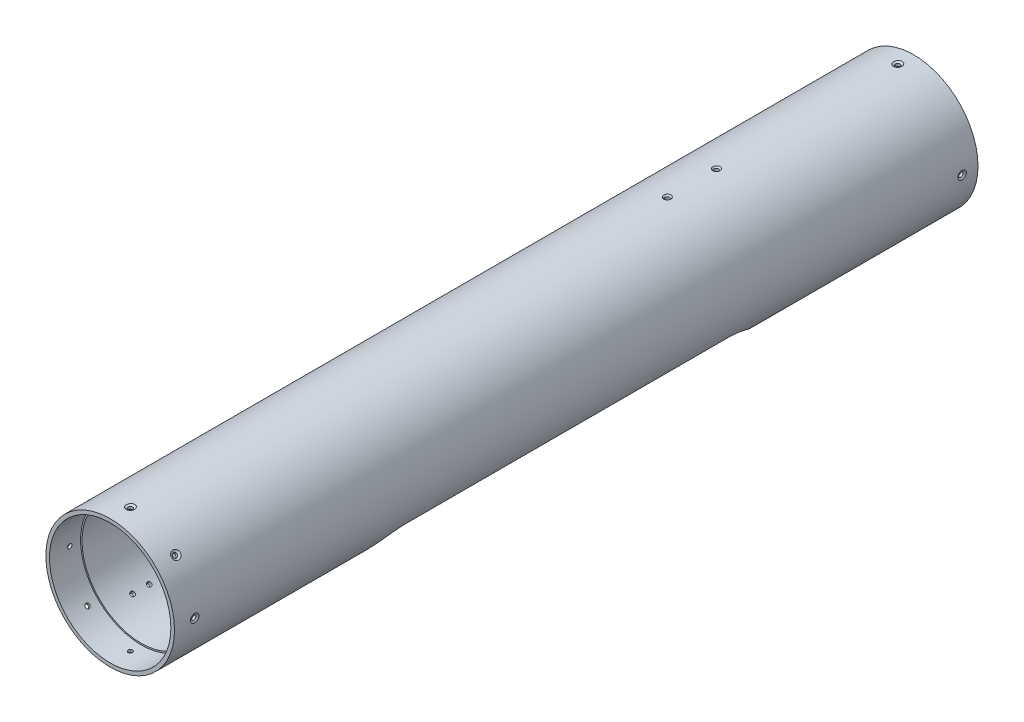
from build123d import *

# Parameters (mm, degrees)
ESQUISSE1_R                  = 44.5
ESQUISSE1_R_2                = 41
BOSS_EXTRU_1_DEPTH           = 556
D_GAGEMENT_M2_51_D           = 3.1
D_GAGEMENT_M2_51_CSINK_D     = 6
D_GAGEMENT_M2_51_CSINK_ANGLE = 120
R_P_TITION_CIRCULAIRE1_COUNT = 4
D_GAGEMENT_M2_52_D           = 3.1
D_GAGEMENT_M2_52_CSINK_D     = 6
D_GAGEMENT_M2_52_CSINK_ANGLE = 120
R_P_TITION_CIRCULAIRE2_COUNT = 8
ENL_V_MAT_EXTRU_1_DEPTH      = 111.46
ENL_V_MAT_EXTRU_1_DEPTH_BACK = 111.46
ENL_V_MAT_EXTRU_2_DEPTH      = 560.550265954
ESQUISSE9_R                  = 42
ESQUISSE9_R_2                = 41
ENL_V_MAT_EXTRU_3_DEPTH      = 18
ENL_V_START                  = -21.5
ESQUISSE10_R                 = 42
ESQUISSE10_R_2               = 41
ENL_V_MAT_EXTRU_4_DEPTH      = 21.5
D_GAGEMENT_M31_D             = 3.1
D_GAGEMENT_M31_CSINK_D       = 5
D_GAGEMENT_M31_CSINK_ANGLE   = 90


with BuildPart() as part:
    # Esquisse1 → Boss.-Extru.1 (new body)
    with BuildSketch(Plane.XY):
        Circle(ESQUISSE1_R)
        Circle(ESQUISSE1_R_2, mode=Mode.SUBTRACT)
    extrude(amount=BOSS_EXTRU_1_DEPTH)

    # Dégagement M2.51 (through all)
    with Locations(Plane(origin=(44.5, 0, 11), x_dir=(0, 1, 0), z_dir=(1, 0, 0))):
        with Locations((0, 0)):
            d_gagement_m2_51 = CounterSinkHole(D_GAGEMENT_M2_51_D / 2, D_GAGEMENT_M2_51_CSINK_D / 2, counter_sink_angle=D_GAGEMENT_M2_51_CSINK_ANGLE)

    # Répétition circulaire1: Dégagement M2.51 ×4 about axis
    r_p_tition_circulaire1_axis = Axis((0, 0, 0), (0, 0, 1))
    for i in range(1, R_P_TITION_CIRCULAIRE1_COUNT):
        add(d_gagement_m2_51.rotate(r_p_tition_circulaire1_axis, i * 360 / R_P_TITION_CIRCULAIRE1_COUNT), mode=Mode.SUBTRACT)

    # Dégagement M2.52 (through all)
    with Locations(Plane(origin=(-44.5, 0, 542), x_dir=(0, 0, -1), z_dir=(-1, 0, 0))):
        with Locations((0, 0)):
            d_gagement_m2_52 = CounterSinkHole(D_GAGEMENT_M2_52_D / 2, D_GAGEMENT_M2_52_CSINK_D / 2, counter_sink_angle=D_GAGEMENT_M2_52_CSINK_ANGLE)

    # Répétition circulaire2: Dégagement M2.52 ×8 about axis
    r_p_tition_circulaire2_axis = Axis((0, 0, 556), (0, 0, 1))
    for i in range(1, R_P_TITION_CIRCULAIRE2_COUNT):
        add(d_gagement_m2_52.rotate(r_p_tition_circulaire2_axis, i * 360 / R_P_TITION_CIRCULAIRE2_COUNT), mode=Mode.SUBTRACT)

    # Esquisse4 → Enlèv. mat.-Extru.1 (cut, two sides: drawn at the far end of the back side and taken through both)
    with BuildSketch(Plane.XY.offset(278).offset(-ENL_V_MAT_EXTRU_1_DEPTH_BACK)):
        with BuildLine():
            Line((-38.538130468, 0), (38.538130468, 0))
            Line((38.538130468, 0), (38.538130468, -22.25))
            ThreePointArc((38.538130468, -22.25), (0, -44.5), (-38.538130468, -22.25))
            Line((-38.538130468, -22.25), (-38.538130468, 0))
        make_face()
    extrude(amount=ENL_V_MAT_EXTRU_1_DEPTH + ENL_V_MAT_EXTRU_1_DEPTH_BACK, mode=Mode.SUBTRACT)

    # Esquisse5 → Enlèv. mat.-Extru.2 (cut, through all)
    with BuildSketch(Plane(origin=(0, 0, 0), x_dir=(1, 0, 0), z_dir=(0, 1, 0))):
        with BuildLine():
            Line((-38.538130468, -389.46), (38.538130468, -389.46))
            ThreePointArc((38.538130468, -389.46), (0, -427.998130468), (-38.538130468, -389.46))
        make_face()
    enl_v_mat_extru_2 = extrude(amount=-ENL_V_MAT_EXTRU_2_DEPTH, mode=Mode.SUBTRACT)

    # Symétrie1: Enlèv. mat.-Extru.2 across plane
    add(enl_v_mat_extru_2.mirror(Plane.XY.offset(278)), mode=Mode.SUBTRACT)

    # Dégagement M2.53: read off the stored shape, not the designer's step
    # Dégagement M2.53 outline → Dégagement M2.53 (revolve, cut)
    with BuildSketch(Plane(origin=(0, 0, 504.5), x_dir=(0.8018799372965583, 0.5974852016253355, 0), z_dir=(0, 0, -1))):
        Polygon((3.000092275, 44.500053275), (0, 44.500053275), (0, 40.970674984), (1.55, 40.970674984), (1.55, 43.66284211), align=None)
    d_gagement_m2_53 = revolve(axis=Axis((0, 0, 504.5), (0.5974852016253355, -0.8018799372965583, 0)), mode=Mode.SUBTRACT)

    # D_gagement M2.53 2 outline → D_gagement M2.53 2 (revolve, cut)
    with BuildSketch(Plane(origin=(0, 0, 504.5), x_dir=(0.8018799372965586, -0.5974852016253349, 0), z_dir=(0, 0, 1))):
        Polygon((0, -44.500051981), (3.000090033, -44.500051981), (1.55, -43.66284211), (1.55, -40.970674984), (0, -40.970674984), align=None)
    d_gagement_m2_53_2 = revolve(axis=Axis((0, 0, 504.5), (0.5974852016253349, 0.8018799372965586, 0)), mode=Mode.SUBTRACT)

    # D_gagement M2.53 3 outline → D_gagement M2.53 3 (revolve, cut)
    with BuildSketch(Plane(origin=(0, 0, 516), x_dir=(0.8018799372965586, -0.5974852016253349, 0), z_dir=(0, 0, 1))):
        Polygon((0, -44.500051981), (3.000090033, -44.500051981), (1.55, -43.66284211), (1.55, -40.970674984), (0, -40.970674984), align=None)
    d_gagement_m2_53_3 = revolve(axis=Axis((0, 0, 516), (0.5974852016253349, 0.8018799372965586, 0)), mode=Mode.SUBTRACT)

    # D_gagement M2.53 4 outline → D_gagement M2.53 4 (revolve, cut)
    with BuildSketch(Plane(origin=(0, 0, 516), x_dir=(0.8018799372965583, 0.5974852016253355, 0), z_dir=(0, 0, -1))):
        Polygon((3.000092275, 44.500053275), (0, 44.500053275), (0, 40.970674984), (1.55, 40.970674984), (1.55, 43.66284211), align=None)
    d_gagement_m2_53_4 = revolve(axis=Axis((0, 0, 516), (0.5974852016253355, -0.8018799372965583, 0)), mode=Mode.SUBTRACT)

    # Symétrie2: Dégagement M2.53, D_gagement M2.53 2, D_gagement M2.53 3, D_gagement M2.53 4 across plane
    add(d_gagement_m2_53.mirror(Plane.XY.offset(278)), mode=Mode.SUBTRACT)
    add(d_gagement_m2_53_2.mirror(Plane.XY.offset(278)), mode=Mode.SUBTRACT)
    add(d_gagement_m2_53_3.mirror(Plane.XY.offset(278)), mode=Mode.SUBTRACT)
    add(d_gagement_m2_53_4.mirror(Plane.XY.offset(278)), mode=Mode.SUBTRACT)

    # Esquisse9 → Enlèv. mat.-Extru.3 (cut)
    with BuildSketch(Plane(origin=(0, 0, 0), x_dir=(-1, 0, 0), z_dir=(0, 0, -1))):
        Circle(ESQUISSE9_R)
        Circle(ESQUISSE9_R_2, mode=Mode.SUBTRACT)
    extrude(amount=-ENL_V_MAT_EXTRU_3_DEPTH, mode=Mode.SUBTRACT)

    # Esquisse10 → Enlèv. mat.-Extru.4 (cut)
    with BuildSketch(Plane.XY.offset(556).offset(ENL_V_START)):
        with Locations(Location((0, 0, 0), (0, 0, 180))):
            Circle(ESQUISSE10_R)
        with Locations(Location((0, 0, 0), (0, 0, 180))):
            Circle(ESQUISSE10_R_2, mode=Mode.SUBTRACT)
    extrude(amount=ENL_V_MAT_EXTRU_4_DEPTH, mode=Mode.SUBTRACT)

    # Dégagement M31 (through all)
    with Locations(Plane(origin=(0, 44.5, 170.5), x_dir=(1, 0, 0), z_dir=(0, 1, 0))):
        with Locations((0, 0), (0, 34)):
            CounterSinkHole(D_GAGEMENT_M31_D / 2, D_GAGEMENT_M31_CSINK_D / 2, counter_sink_angle=D_GAGEMENT_M31_CSINK_ANGLE)


solid = part.part
